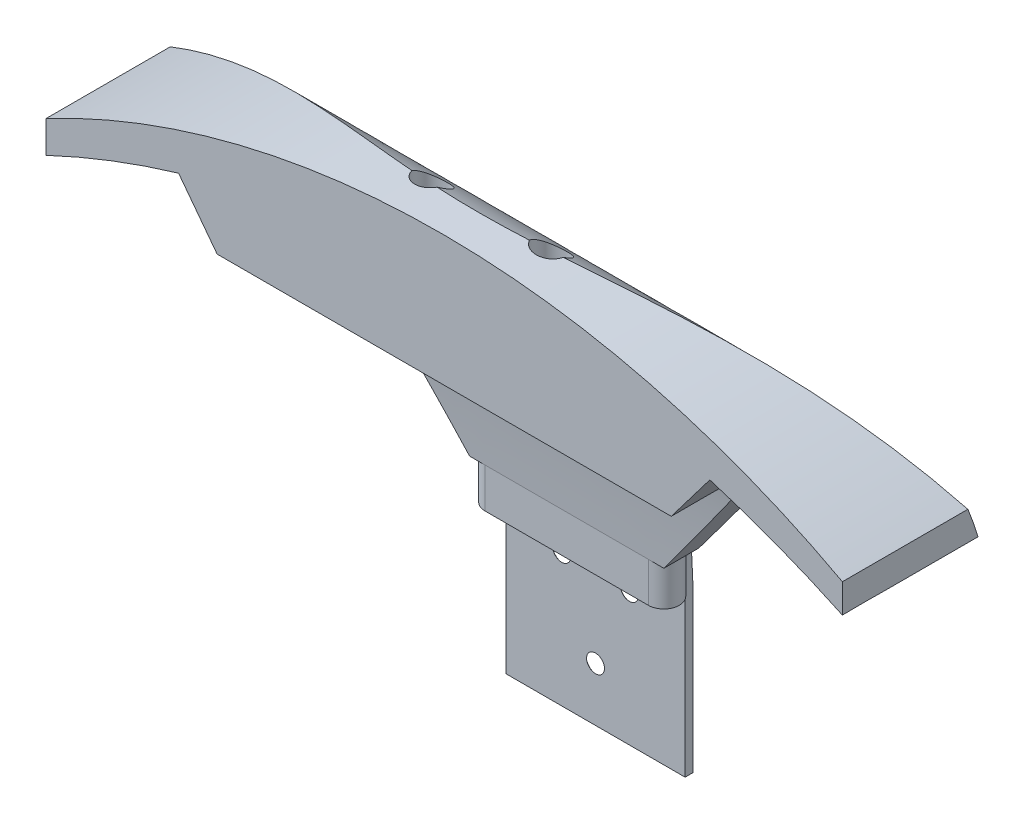
from build123d import *

# Parameters (mm, degrees)
SKETCH1_W             = 45
SKETCH1_H             = 40
BOSS_EXTRUDE1_DEPTH   = 2
BOSS_EXTRUDE2_DEPTH   = 10
SKETCH3_W             = 41
SKETCH3_H             = 9.23
BOSS_EXTRUDE3_DEPTH   = 45
SKETCH4_W             = 41
SKETCH4_H             = 40
SKETCH4_R             = 2
BOSS_EXTRUDE4_DEPTH   = 34
SKETCH6_W             = 41
SKETCH6_H             = 45
BOSS_EXTRUDE5_DEPTH   = 30.77
SKETCH9_W             = 79
SKETCH9_H             = 40
BOSS_EXTRUDE6_DEPTH   = 100
SKETCH10_R            = 2
CUT_EXTRUDE4_DEPTH    = 134.570945561
SKETCH15_R            = 4
CUT_EXTRUDE9_DEPTH    = 32
CUT_EXTRUDE6_DEPTH    = 125
CUT_EXTRUDE5_DEPTH    = 125
SKETCH17_R            = 4.75
CUT_EXTRUDE11_DEPTH   = 3
CUT_EXTRUDE7_DEPTH    = 154.235758058
CUT_EXTRUDE8_DEPTH    = 151.887944239
SKETCH18_R            = 1.75
CUT_EXTRUDE12_DEPTH   = 3
SKETCH19_R            = 2.25
CUT_EXTRUDE13_DEPTH   = 151.887944239
FILLET2_R             = 8
BODY_MOVE_COPY1_ANGLE = 90


with BuildPart() as part:
    # Sketch1 → Boss-Extrude1 (new body)
    with BuildSketch(Plane(origin=(0, 0, 0), x_dir=(1, 0, 0), z_dir=(0, 1, 0))):
        Rectangle(SKETCH1_W, SKETCH1_H)
    extrude(amount=BOSS_EXTRUDE1_DEPTH)

    # Sketch2 → Boss-Extrude2 (add)
    with BuildSketch(Plane(origin=(0, 0, -20), x_dir=(-1, 0, 0), z_dir=(0, 0, -1))):
        with BuildLine():
            Line((-20.5, 9.232468648), (20.5, 9.232468648))
            ThreePointArc((20.5, 9.232468648), (24.251952916, 6.377233936), (22.5, 2))
            Line((22.5, 2), (22.5, 0))
            Line((22.5, 0), (-22.5, 0))
            Line((-22.5, 0), (-22.5, 2))
            ThreePointArc((-22.5, 2), (-24.251952916, 6.377233936), (-20.5, 9.232468648))
        make_face()
    extrude(amount=BOSS_EXTRUDE2_DEPTH)

    # Sketch3 → Boss-Extrude3 (add)
    with BuildSketch(Plane(origin=(0, 0, -30), x_dir=(-1, 0, 0), z_dir=(0, 0, -1))):
        with Locations((0, 4.617468648)):
            Rectangle(SKETCH3_W, SKETCH3_H)
    extrude(amount=BOSS_EXTRUDE3_DEPTH)

    # Sketch4 → Boss-Extrude4 (add)
    with BuildSketch(Plane(origin=(0, 0, -75), x_dir=(-1, 0, 0), z_dir=(0, 0, -1))):
        with Locations((0, 20.002468648)):
            Rectangle(SKETCH4_W, SKETCH4_H)
        with Locations((-15, 35.002468648)):
            Circle(SKETCH4_R, mode=Mode.SUBTRACT)
        with Locations((15, 35.002468648)):
            Circle(SKETCH4_R, mode=Mode.SUBTRACT)
    extrude(amount=BOSS_EXTRUDE4_DEPTH)

    # Sketch6 → Boss-Extrude5 (add)
    with BuildSketch(Plane(origin=(0, 9.232468648, 0), x_dir=(1, 0, 0), z_dir=(0, 1, 0))):
        with Locations((0, 52.5)):
            Rectangle(SKETCH6_W, SKETCH6_H)
    extrude(amount=BOSS_EXTRUDE5_DEPTH)

    # Sketch9 → Boss-Extrude6 (add, symmetric)
    with BuildSketch(Plane(origin=(0, 0, 0), x_dir=(0, 0, -1), z_dir=(1, 0, 0))):
        with Locations((69.5, 20.002468648)):
            Rectangle(SKETCH9_W, SKETCH9_H)
    extrude(amount=BOSS_EXTRUDE6_DEPTH, both=True)

    # Sketch10 → Cut-Extrude4 (cut, through all)
    with BuildSketch(Plane.XY.offset(-30)):
        with Locations((-15, 28.162020226)):
            Circle(SKETCH10_R)
        with Locations((15, 28.162020226)):
            Circle(SKETCH10_R)
    extrude(amount=-CUT_EXTRUDE4_DEPTH, mode=Mode.SUBTRACT)

    # Sketch15 → Cut-Extrude9 (cut)
    with BuildSketch(Plane(origin=(0, 0, -109), x_dir=(-1, 0, 0), z_dir=(0, 0, -1))):
        with Locations((15, 28.162020226)):
            Circle(SKETCH15_R)
        with Locations((-15, 28.162020226)):
            Circle(SKETCH15_R)
    extrude(amount=-CUT_EXTRUDE9_DEPTH, mode=Mode.SUBTRACT)

    # Sketch7 → Cut-Extrude6 (cut, symmetric)
    with BuildSketch(Plane(origin=(0, 0, 0), x_dir=(0, 0, -1), z_dir=(1, 0, 0))):
        with BuildLine():
            Line((20, 0), (20, -8.934645758))
            Line((20, -8.934645758), (79, -8.934645758))
            Line((79, -8.934645758), (89.171730085, -8.934645758))
            Line((89.171730085, -8.934645758), (121.54334061, -8.934645758))
            Line((121.54334061, -8.934645758), (121.54334061, 40.002468648))
            Line((121.54334061, 40.002468648), (109, 40.002468648))
            add(Edge.make_bspline(
                [(20, 0), (42.897118776, 1.579710538), (98.670327942, -1.827117377), (109, 40.002468648)],
                knots=[0, 0, 0, 0, 1, 1, 1, 1], degree=3))
        make_face()
    extrude(amount=CUT_EXTRUDE6_DEPTH, both=True, mode=Mode.SUBTRACT)

    # Sketch11 → Cut-Extrude5 (cut, symmetric)
    with BuildSketch(Plane(origin=(0, 0, 0), x_dir=(0, 0, -1), z_dir=(1, 0, 0))):
        with BuildLine():
            Line((30, 9.232468648), (8.554895473, 9.232468648))
            Line((8.554895473, 9.232468648), (8.554895473, 44.846273678))
            Line((8.554895473, 44.846273678), (73, 44.846273678))
            Line((73, 44.846273678), (73, 40.002468648))
            add(Edge.make_bspline(
                [(30, 9.232468648), (63.887291081, 12.131462064), (70.931504543, 16.175024343), (73.260707956, 23.18230742), (73, 40.002468648)],
                knots=[0, 0, 0, 0, 0.671043055, 1, 1, 1, 1], degree=3))
        make_face()
    extrude(amount=CUT_EXTRUDE5_DEPTH, both=True, mode=Mode.SUBTRACT)

    # Sketch17 → Cut-Extrude11 (cut)
    with BuildSketch(Plane.XY.offset(-72)):
        with Locations((-15, 28.162020226)):
            Circle(SKETCH17_R)
        with Locations((15, 28.162020226)):
            Circle(SKETCH17_R)
    extrude(amount=-CUT_EXTRUDE11_DEPTH, mode=Mode.SUBTRACT)

    # Sketch13 → Cut-Extrude7 (cut, through all)
    with BuildSketch(Plane(origin=(0, 0, 0), x_dir=(1, 0, 0), z_dir=(0, 1, 0))):
        with BuildLine():
            Line((-100, 81), (-129.474420345, 81))
            Line((-129.474420345, 81), (-129.474420345, 121.578601729))
            Line((-129.474420345, 121.578601729), (107.766794126, 121.578601729))
            Line((107.766794126, 121.578601729), (107.766794126, 80.267101339))
            Line((107.766794126, 80.267101339), (100, 80.267101339))
            ThreePointArc((100, 80.267101339), (0.091754989, 105.672480048), (-100, 81))
        make_face()
    extrude(amount=CUT_EXTRUDE7_DEPTH, mode=Mode.SUBTRACT)

    # Sketch14 → Cut-Extrude8 (cut, through all)
    with BuildSketch(Plane(origin=(0, 40.002468648, 0), x_dir=(1, 0, 0), z_dir=(0, 1, 0))):
        with BuildLine():
            Line((-66.705446664, 85.764119081), (-24.392765077, 30))
            Line((-24.392765077, 30), (-115.920927832, 30))
            Line((-115.920927832, 30), (-115.920927832, 73))
            Line((-115.920927832, 73), (-100, 73))
            ThreePointArc((-100, 73), (-83.59669354, 80.01844338), (-66.705446664, 85.764119081))
        make_face()
        with BuildLine():
            Line((66.705446664, 85.764119081), (24.392765077, 30))
            Line((24.392765077, 30), (119.116466718, 30))
            Line((119.116466718, 30), (119.116466718, 73))
            Line((119.116466718, 73), (100, 73))
            ThreePointArc((100, 73), (83.59669354, 80.01844338), (66.705446664, 85.764119081))
        make_face()
    extrude(amount=-CUT_EXTRUDE8_DEPTH, mode=Mode.SUBTRACT)

    # Sketch18 → Cut-Extrude12 (cut)
    with BuildSketch(Plane.XY.offset(-20)):
        with Locations((20.5, 5.339703571)):
            Circle(SKETCH18_R)
        with Locations((-20.5, 5.339703571)):
            Circle(SKETCH18_R)
    extrude(amount=-CUT_EXTRUDE12_DEPTH, mode=Mode.SUBTRACT)

    # Sketch19 → Cut-Extrude13 (cut, through all)
    with BuildSketch(Plane.XZ):
        with Locations(Location((-8.5, -13.5, 0), (0, 0, 270))):
            Circle(SKETCH19_R)
        with Locations(Location((8.5, -13.5, 0), (0, 0, 270))):
            Circle(SKETCH19_R)
        with Locations(Location((0, 6.5, 0), (0, 0, 270))):
            Circle(SKETCH19_R)
    extrude(amount=-CUT_EXTRUDE13_DEPTH, mode=Mode.SUBTRACT)

    # Fillet2
    # the kernel refuses this fillet: 8 mm, written as the material it takes off along each edge
    with BuildSketch(Plane(origin=(-8.5, 0, -13.5), x_dir=(0, 0, -1), z_dir=(-1, 0, 0))) as fillet2_piece_1:
        with BuildLine():
            CenterArc((7.541502622, -8), FILLET2_R, 90, 41.409622109)
            Line((2.25, -2), (2.144169948, -1.88))
            ThreePointArc((2.144169948, -1.88), (2.09, -1), (2.09, 0))
            Line((2.09, 0), (2.25, 0.16))
            Line((2.25, 0.16), (7.541502622, 0.16))
            Line((7.541502622, 0.16), (7.541502622, 0))
        make_face()
    revolve(axis=Axis((-8.5, 0, -13.5), (0, -1, 0)), mode=Mode.SUBTRACT)
    with BuildSketch(Plane(origin=(8.5, 0, -13.5), x_dir=(0, 0, -1), z_dir=(-1, 0, 0))) as fillet2_piece_2:
        with BuildLine():
            CenterArc((7.541502622, -8), FILLET2_R, 90, 41.409622109)
            Line((2.25, -2), (2.144169948, -1.88))
            ThreePointArc((2.144169948, -1.88), (2.09, -1), (2.09, 0))
            Line((2.09, 0), (2.25, 0.16))
            Line((2.25, 0.16), (7.541502622, 0.16))
            Line((7.541502622, 0.16), (7.541502622, 0))
        make_face()
    revolve(axis=Axis((8.5, 0, -13.5), (0, -1, 0)), mode=Mode.SUBTRACT)
    with BuildSketch(Plane(origin=(0, 0, 6.5), x_dir=(0, 0, -1), z_dir=(-1, 0, 0))) as fillet2_piece_3:
        with BuildLine():
            CenterArc((7.541502622, -8), FILLET2_R, 90, 41.409622109)
            Line((2.25, -2), (2.144169948, -1.88))
            ThreePointArc((2.144169948, -1.88), (2.09, -1), (2.09, 0))
            Line((2.09, 0), (2.25, 0.16))
            Line((2.25, 0.16), (7.541502622, 0.16))
            Line((7.541502622, 0.16), (7.541502622, 0))
        make_face()
    revolve(axis=Axis((0, 0, 6.5), (0, -1, 0)), mode=Mode.SUBTRACT)


with BuildPart() as part_1:
    # Body-Move/Copy1: moved
    add(part.part.rotate(Axis((0, 19.615916964, -42.881523384), (1, 0, 0)), BODY_MOVE_COPY1_ANGLE))


solid = part_1.part
